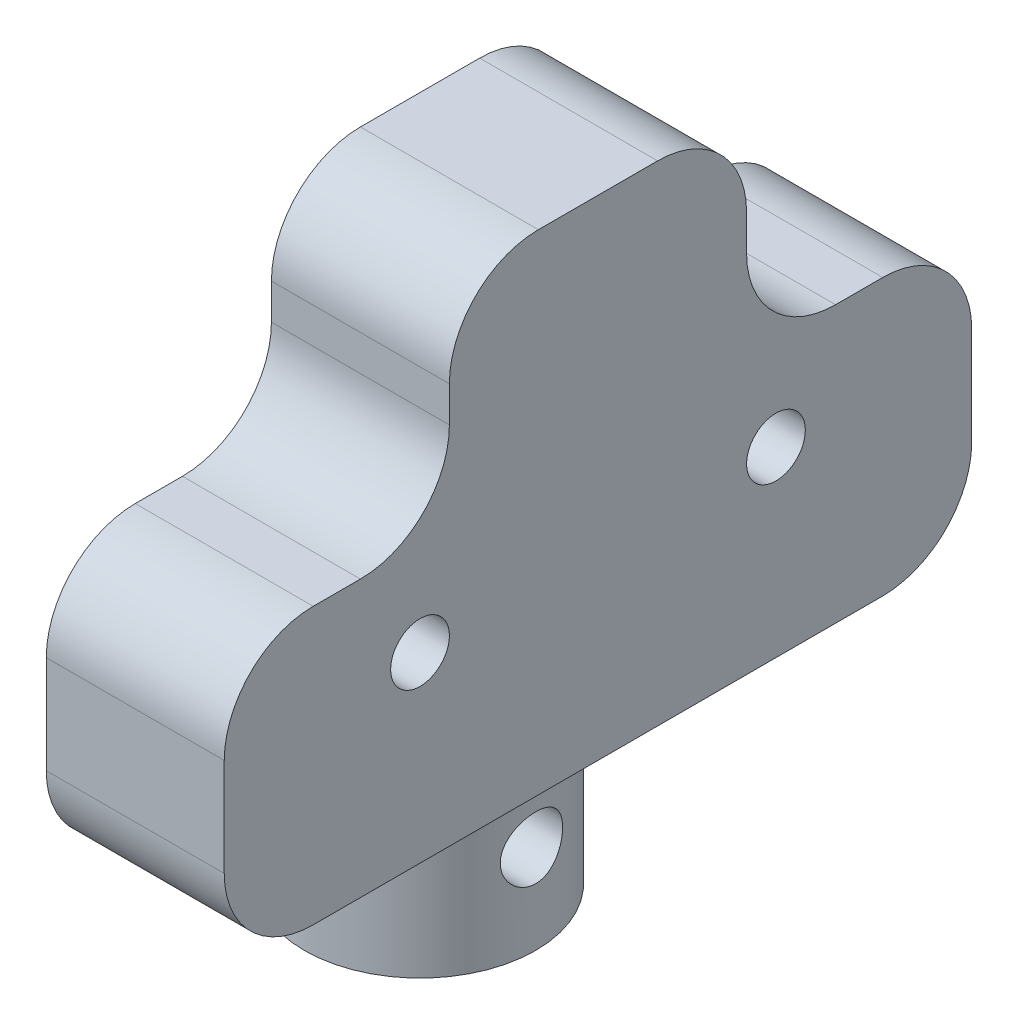
from build123d import *

# Parameters (mm, degrees)
SKETCH1_R               = 1.75
BOSS_EXTRUDE1_DEPTH     = 5
SKETCH2_W               = 10
SKETCH2_H               = 36
BOSS_EXTRUDE2_DEPTH     = 10.5
SKETCH3_R               = 1.75
BOSS_EXTRUDE3_DEPTH     = 5
FILLET1_R               = 5
SKETCH4_R               = 1.65
CUT_EXTRUDE1_DEPTH      = 43.444080859
SKETCH5_R               = 6.5
SKETCH5_R_2             = 2.5
BOSS_EXTRUDE4_DEPTH     = 11
BOSS_EXTRUDE5_START     = 5
BOSS_EXTRUDE5_DEPTH     = 5
CUT_EXTRUDE2_DEPTH      = 41.267853183
CUT_EXTRUDE2_DEPTH_BACK = 41.267853183
SKETCH7_R               = 1.75
FILLET2_R               = 5
FILLET3_R               = 5
SKETCH9_W               = 13.35
SKETCH9_H               = 12
BOSS_EXTRUDE6_DEPTH     = 10
CHAMFER2_SIZE           = 3
CHAMFER3_SIZE           = 3
FILLET6_R               = 2
SKETCH14_R              = 1.75
BOSS_EXTRUDE9_DEPTH     = 7
FILLET7_R               = 10
CUT_EXTRUDE7_DEPTH      = 52.802509666
CUT_EXTRUDE7_DEPTH_BACK = 52.802509666
CUT_EXTRUDE8_START      = -12
CUT_EXTRUDE8_DEPTH      = 12
SKETCH19_W              = 10
SKETCH19_H              = 15.5
BOSS_EXTRUDE10_DEPTH    = 10
BOSS_EXTRUDE11_START    = -27.5
BOSS_EXTRUDE11_DEPTH    = 27.5
CUT_EXTRUDE9_DEPTH      = 25
FILLET10_R              = 5


# Read off the part's stored shape, not the designer's step: Cut-Extrude8, Cut-Extrude9
with BuildPart() as part:
    # Sketch1 → Boss-Extrude1 (new body)
    with BuildSketch(Plane(origin=(0, 0, 0), x_dir=(1, 0, 0), z_dir=(0, 1, 0))):
        with BuildLine():
            Line((0, 5), (5.5, 5))
            Line((5.5, 5), (5.5, 31))
            Line((5.5, 31), (15.5, 31))
            Line((15.5, 31), (15.5, -5))
            Line((15.5, -5), (5.5, -5))
            Line((5.5, -5), (0, -5))
            ThreePointArc((0, -5), (-5, 0), (0, 5))
        make_face()
        with Locations(Location((0, 0, 0), (0, 0, 270))):
            Circle(SKETCH1_R, mode=Mode.SUBTRACT)
    extrude(amount=BOSS_EXTRUDE1_DEPTH)

    # Sketch2 → Boss-Extrude2 (add)
    with BuildSketch(Plane(origin=(0, 5, 0), x_dir=(1, 0, 0), z_dir=(0, 1, 0))):
        with Locations((10.5, 13)):
            Rectangle(SKETCH2_W, SKETCH2_H)
    extrude(amount=BOSS_EXTRUDE2_DEPTH)

    # Sketch3 → Boss-Extrude3 (add)
    with BuildSketch(Plane(origin=(0, 15.5, 0), x_dir=(1, 0, 0), z_dir=(0, 1, 0))):
        with BuildLine():
            Line((5.5, 5), (15.5, 5))
            Line((15.5, 5), (15.5, -5))
            Line((15.5, -5), (5.5, -5))
            Line((5.5, -5), (0, -5))
            ThreePointArc((0, -5), (-5, 0), (0, 5))
            Line((0, 5), (5.5, 5))
        make_face()
        with Locations(Location((0, 0, 0), (0, 0, 270))):
            Circle(SKETCH3_R, mode=Mode.SUBTRACT)
    extrude(amount=BOSS_EXTRUDE3_DEPTH)

    # Fillet1
    fillet1_edges = [part.edges().sort_by_distance(p)[0] for p in [
        (15.5, 10.25, 5),
    ]]
    fillet(fillet1_edges, radius=FILLET1_R)

    # Sketch4 → Cut-Extrude1 (cut, through all)
    with BuildSketch(Plane(origin=(15.5, 0, 0), x_dir=(0, 0, -1), z_dir=(1, 0, 0))):
        with Locations((20, 10.25)):
            Circle(SKETCH4_R)
    extrude(amount=-CUT_EXTRUDE1_DEPTH, mode=Mode.SUBTRACT)

    # Sketch5 → Boss-Extrude4 (add)
    with BuildSketch(Plane.XZ):
        with Locations(Location((5.5, -10, 0), (0, 0, 270))):
            Circle(SKETCH5_R)
        with Locations(Location((5.5, -10, 0), (0, 0, 270))):
            Circle(SKETCH5_R_2, mode=Mode.SUBTRACT)
    extrude(amount=BOSS_EXTRUDE4_DEPTH)

    # Sketch6 → Boss-Extrude5 (add)
    with BuildSketch(Plane(origin=(0, 0, 0), x_dir=(1, 0, 0), z_dir=(0, 1, 0)).offset(BOSS_EXTRUDE5_START)):
        with BuildLine():
            Line((5.5, 12.5), (5.5, 16.5))
            ThreePointArc((5.5, 16.5), (-0.61350963, 12.207940217), (1.346688069, 5))
            Line((1.346688069, 5), (5.5, 5))
            Line((5.5, 5), (5.5, 7.5))
            ThreePointArc((5.5, 7.5), (3, 10), (5.5, 12.5))
        make_face()
    extrude(amount=-BOSS_EXTRUDE5_DEPTH)

    # Sketch7 → Cut-Extrude2 (cut, two sides: drawn at the far end of the back side and taken through both)
    with BuildSketch(Plane(origin=(0, 0, 0), x_dir=(0, 0, -1), z_dir=(1, 0, 0)).offset(-CUT_EXTRUDE2_DEPTH_BACK)):
        with Locations((10, -6)):
            Circle(SKETCH7_R)
    extrude(amount=CUT_EXTRUDE2_DEPTH + CUT_EXTRUDE2_DEPTH_BACK, mode=Mode.SUBTRACT)

    # Fillet2
    fillet2_edges = [part.edges().sort_by_distance(p)[0] for p in [
        (10.5, 15.5, -31),
        (10.5, 0, -31),
    ]]
    fillet(fillet2_edges, radius=FILLET2_R)

    # Fillet3
    # the kernel refuses this fillet: 5 mm, written as the material it adds along each edge
    with BuildSketch(Plane(origin=(15.5, 15.5, -5), x_dir=(0, 0, -1), z_dir=(-1, 0, 0))) as fillet3_piece_1:
        with BuildLine():
            CenterArc((FILLET3_R, -FILLET3_R), FILLET3_R, 90, 90)
            Line((0, -FILLET3_R), (0, 0))
            Line((0, 0), (FILLET3_R, 0))
        make_face()
    extrude(amount=10)

    # Sketch9 → Boss-Extrude6 (add)
    with BuildSketch(Plane.ZY.offset(-5.5)):
        with Locations((-11.675, 21.5)):
            Rectangle(SKETCH9_W, SKETCH9_H)
    extrude(amount=-BOSS_EXTRUDE6_DEPTH)

    # Chamfer2
    chamfer2_edges = [part.edges().sort_by_distance(p)[0] for p in [
        (5.5, -11, -7.5),
    ]]
    chamfer(chamfer2_edges, length=CHAMFER2_SIZE)

    # Chamfer3
    # the kernel refuses this chamfer: 3 mm, written as the material it takes off along each edge
    with BuildSketch(Plane(origin=(5.5, 0, 0.215048964), x_dir=(-0.02749587661058649, 0.9996219169112968, 0), z_dir=(0, 0, -1))) as chamfer3_piece_1_section:
        Polygon((CHAMFER3_SIZE * 0.999621916911, CHAMFER3_SIZE * 0.0274958766106), (-CHAMFER3_SIZE * 0.0274958766106, CHAMFER3_SIZE * 0.999621916911), (0, 0), align=None)
    chamfer3_piece_1 = extrude(amount=20.430097928, mode=Mode.PRIVATE)
    chamfer3_piece_1 = chamfer3_piece_1 & Plane(origin=(5.5, 1.082097371, -10), x_dir=(0, 0, 1), z_dir=(0, 1, 0)) * Cylinder(2.5, 53, mode=Mode.PRIVATE)
    add(chamfer3_piece_1, mode=Mode.SUBTRACT)

    # Fillet6
    fillet6_edges = [part.edges().sort_by_distance(p)[0] for p in [
        (3, 5, -10),
    ]]
    fillet(fillet6_edges, radius=FILLET6_R)

    # Sketch14 → Boss-Extrude9 (add)
    with BuildSketch(Plane(origin=(0, 20.5, 0), x_dir=(1, 0, 0), z_dir=(0, 1, 0))):
        with BuildLine():
            Line((0, -5), (10.5, -5))
            ThreePointArc((10.5, -5), (14.035533906, -3.535533906), (15.5, 0))
            Line((15.5, 0), (15.5, 5))
            Line((15.5, 5), (5.5, 5))
            Line((5.5, 5), (0, 5))
            ThreePointArc((0, 5), (-5, 0), (0, -5))
        make_face()
        with Locations(Location((0, 0, 0), (0, 0, 270))):
            Circle(SKETCH14_R, mode=Mode.SUBTRACT)
    extrude(amount=BOSS_EXTRUDE9_DEPTH)

    # Fillet7
    # the kernel refuses this fillet: 10 mm, written as the material it adds along each edge
    with BuildSketch(Plane(origin=(1.346688069, 5, -5), x_dir=(-0.41939386698079784, 0, -0.9078043755891976), z_dir=(0, -1, 0))) as fillet7_piece_1:
        with BuildLine():
            CenterArc((9.89760177, -9.026713968), FILLET7_R, 115.488537073, 42.147981554)
            Line((0.649714482, -5.22190376), (-0.275074246, -4.841422739))
            ThreePointArc((-0.275074246, -4.841422739), (-0.343011659, -1.641923188), (-0.907804376, -0.419393867))
            Line((-0.907804376, -0.419393867), (0.430330512, 0.902671397))
            ThreePointArc((0.430330512, 0.902671397), (2.797148326, 0.367364079), (5.163966141, 0.902671397))
            Line((5.163966141, 0.902671397), (5.594296652, 0))
        make_face()
    extrude(amount=5)

    # Sketch17 → Cut-Extrude7 (cut, two sides: drawn at the far end of the back side and taken through both)
    with BuildSketch(Plane(origin=(0, 27.5, 0), x_dir=(1, 0, 0), z_dir=(0, 1, 0)).offset(-CUT_EXTRUDE7_DEPTH_BACK)):
        with BuildLine():
            Line((5.5, 3.5), (5.5, -5))
            Line((5.5, -5), (0, -5))
            ThreePointArc((0, -5), (-4.582515477, -2.000137971), (-3.666265283, 3.399779239))
            ThreePointArc((-3.666265283, 3.399779239), (-1.711748558, 6.491136994), (-0.999525638, 10.078526979))
            ThreePointArc((-0.999525638, 10.078526979), (0.876125793, 5.431653766), (5.5, 3.5))
        make_face()
    extrude(amount=CUT_EXTRUDE7_DEPTH + CUT_EXTRUDE7_DEPTH_BACK, mode=Mode.SUBTRACT)

    # Cut-Extrude8 outline → Cut-Extrude8 (cut)
    with BuildSketch(Plane.XZ.offset(-15.5).offset(CUT_EXTRUDE8_START)):
        with BuildLine():
            Line((1.346688069, -5), (5.5, -5))
            Line((5.5, -5), (5.5, -3.5))
            ThreePointArc((5.5, -3.5), (3.292059784, -3.88649037), (1.346688069, -5))
        make_face()
    extrude(amount=CUT_EXTRUDE8_DEPTH, mode=Mode.SUBTRACT)

    # Sketch19 → Boss-Extrude10 (add)
    with BuildSketch(Plane.ZY.offset(-5.5)):
        with Locations((10, 7.75)):
            Rectangle(SKETCH19_W, SKETCH19_H)
    extrude(amount=-BOSS_EXTRUDE10_DEPTH)

    # Sketch20 → Boss-Extrude11 (add)
    with BuildSketch(Plane.XZ.offset(BOSS_EXTRUDE11_START)):
        with BuildLine():
            Line((15.5, 5), (15.5, 0))
            ThreePointArc((15.5, 0), (14.035533906, 3.535533906), (10.5, 5))
            Line((10.5, 5), (15.5, 5))
        make_face()
    extrude(amount=BOSS_EXTRUDE11_DEPTH)

    # Cut-Extrude9 outline → Cut-Extrude9 (cut)
    with BuildSketch(Plane(origin=(0, 0, -10), x_dir=(0, 1, 0), z_dir=(0, 0, 1))):
        Polygon((5, 1), (-11, 1), (-11, -15.5), (27.5, -15.5), (27.5, -5.5), (5, -5.5), align=None)
    extrude(amount=CUT_EXTRUDE9_DEPTH, mode=Mode.SUBTRACT)

    # Fillet10
    fillet10_edges = [part.edges().sort_by_distance(p)[0] for p in [
        (10.5, 15.5, -18.35),
        (10.5, 27.5, -18.35),
    ]]
    fillet(fillet10_edges, radius=FILLET10_R)

    # Mirror1: part across plane


with BuildPart() as part_1:
    add(part.part)
    add(part.part.mirror(Plane.XY.offset(-10)))


solid = part_1.part
